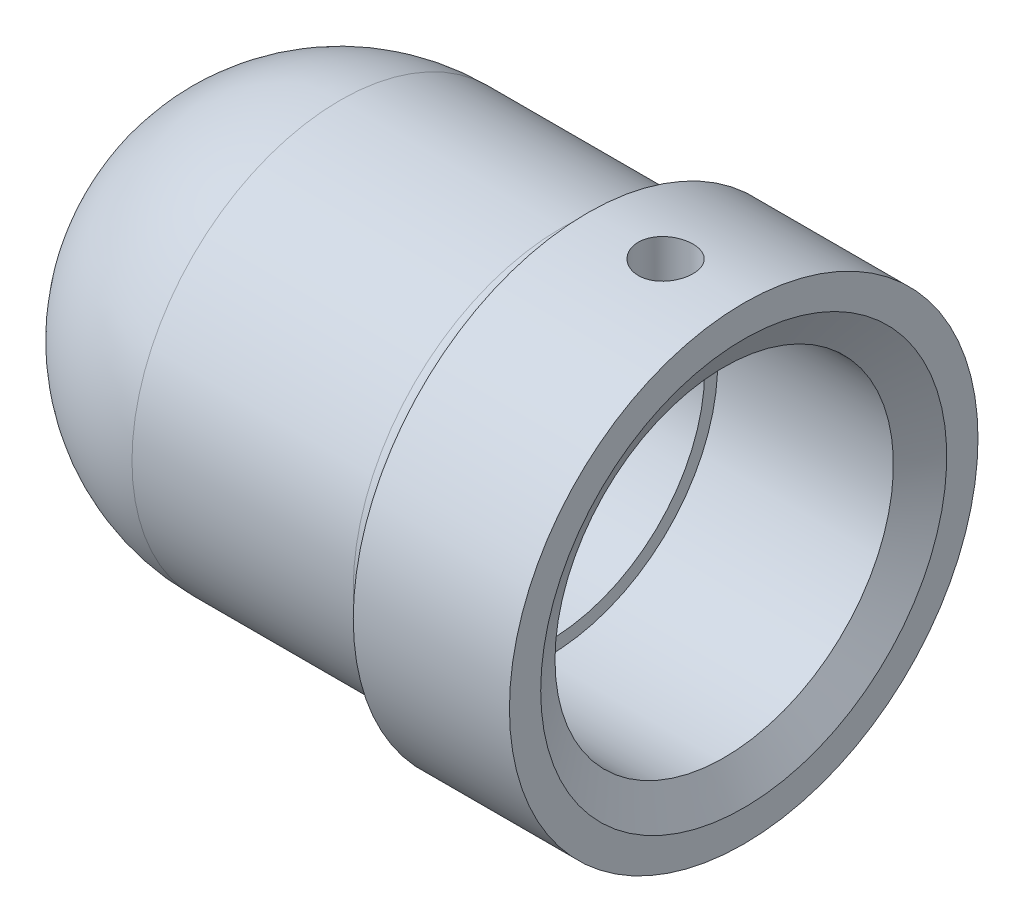
from build123d import *

# Parameters (mm, degrees)
FILLET_1_R             = 2
CHAMFER_1_SIZE         = 1.5
CHAMFER_1_SIZE2        = 2.598076211
HOLE_WIZARD_M5_1_D     = 4.2
HOLE_WIZARD_M5_1_DEPTH = 12.4
HOLE_WIZARD_M5_1_TIP   = 1.2618073


with BuildPart() as part:
    # 草图1 → 旋转1 (revolve)
    with BuildSketch(Plane.XY, mode=Mode.PRIVATE) as revolve_1_sk:
        with BuildLine():
            Line((0, 13), (0, 18))
            Line((0, 18), (-12, 18))
            Line((-12, 18), (-12, 16))
            Line((-12, 16), (-31, 16))
            ThreePointArc((-31, 16), (-42.313708499, 11.313708499), (-47, 0))
            Line((-47, 0), (-43, 0))
            ThreePointArc((-43, 0), (-39.485281374, 8.485281374), (-31, 12))
            Line((-31, 12), (-15, 12))
            Line((-15, 12), (-15, 13))
            Line((-15, 13), (0, 13))
        make_face()
    revolve(revolve_1_sk.sketch.rotate(Axis((-47, 0, 0), (1, 0, 0)), 90), axis=Axis((-47, 0, 0), (1, 0, 0)))

    # 圆角1
    fillet_1_edges = [part.edges().sort_by_distance(p)[0] for p in [
        (-12, 0, -16),
    ]]
    fillet(fillet_1_edges, radius=FILLET_1_R - 0.0001)  # a hair under: the kernel refuses the full size

    # 倒角1
    chamfer_1_edges = [part.edges().sort_by_distance(p)[0] for p in [
        (0, 0, -13),
    ]]
    chamfer_1_side = [part.faces().sort_by_distance(p)[0] for p in [
        (-7.5, 0, -13),
    ]]
    chamfer(chamfer_1_edges, length=CHAMFER_1_SIZE, length2=CHAMFER_1_SIZE2, reference=chamfer_1_side[0])

    # M5 螺纹孔1
    with Locations(Plane(origin=(-6, 18, 0), x_dir=(0, 0, 1), z_dir=(0, 1, 0))):
        with Locations((0, 0)):
            Hole(HOLE_WIZARD_M5_1_D / 2, depth=HOLE_WIZARD_M5_1_DEPTH)
            with Locations((0, 0, -(HOLE_WIZARD_M5_1_DEPTH + HOLE_WIZARD_M5_1_TIP / 2))):  # 118° drill point
                Cone(0, HOLE_WIZARD_M5_1_D / 2, HOLE_WIZARD_M5_1_TIP, mode=Mode.SUBTRACT)


solid = part.part
